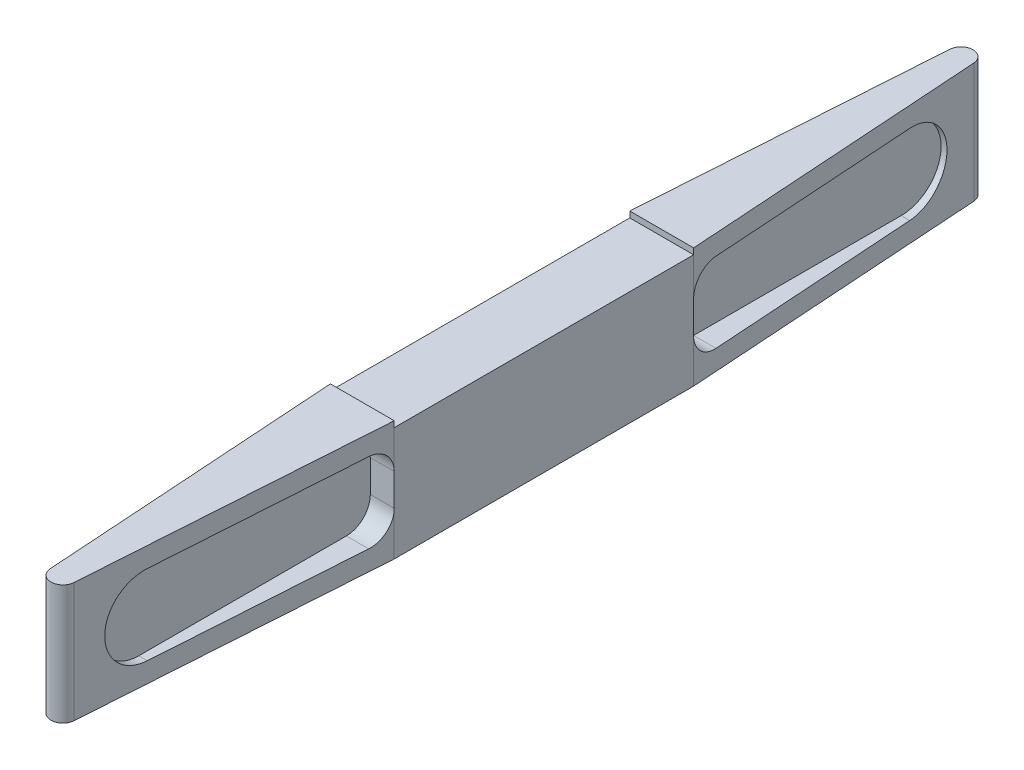
from build123d import *

# Parameters (mm, degrees)
BASE_EXTRUDE_DEPTH   = 30
CUT_EXTRUDE1_DEPTH   = 6
FILLET1_R            = 6
FILLET1_OF_MIRROR1_R = 6
MIRROR2_START        = -8
MIRROR2_DEPTH        = 6
MIRROR2_START_2      = 2
MIRROR2_2_DEPTH      = 6
SKETCH5_W            = 16
SKETCH5_H            = 75
CUT_EXTRUDE3_DEPTH   = 1.5


# Read off the part's stored shape, not the designer's step: Mirror2
with BuildPart() as part:
    # Sketch1 → Base-Extrude (new body)
    with BuildSketch(Plane(origin=(0, 0, 0), x_dir=(1, 0, 0), z_dir=(0, 1, 0))):
        with BuildLine():
            Line((8, 37.5), (2.993373056, 112.699293126))
            ThreePointArc((2.993373056, 112.699293126), (0, 115.5), (-2.993373056, 112.699293126))
            Line((-2.993373056, 112.699293126), (-8, 37.5))
            Line((-8, 37.5), (-8, -37.5))
            Line((-8, -37.5), (-2.993373056, -112.699293126))
            ThreePointArc((-2.993373056, -112.699293126), (0, -115.5), (2.993373056, -112.699293126))
            Line((2.993373056, -112.699293126), (8, -37.5))
            Line((8, -37.5), (8, 37.5))
        make_face()
    extrude(amount=BASE_EXTRUDE_DEPTH)

    # Sketch2 → Cut-Extrude1 (cut)
    with BuildSketch(Plane(origin=(8, 0, 0), x_dir=(0, 0, -1), z_dir=(1, 0, 0))):
        with BuildLine():
            Line((-37.5, 5), (-95.5, 5))
            ThreePointArc((-95.5, 5), (-105.5, 15), (-95.5, 25))
            Line((-95.5, 25), (-37.5, 25))
            Line((-37.5, 25), (-37.5, 5))
        make_face()
    cut_extrude1 = extrude(amount=-CUT_EXTRUDE1_DEPTH, mode=Mode.SUBTRACT)

    # Fillet1
    fillet1_edges = [part.edges().sort_by_distance(p)[0] for p in [
        (5, 25, 37.5),
        (5, 5, 37.5),
    ]]
    fillet(fillet1_edges, radius=FILLET1_R)

    # Mirror1: Cut-Extrude1 across plane
    add(cut_extrude1.mirror(Plane(origin=(0, 0, 0), x_dir=(0, 0, 1), z_dir=(1, 0, 0))), mode=Mode.SUBTRACT)

    # Fillet1 of Mirror1
    fillet1_of_mirror1_edges = [part.edges().sort_by_distance(p)[0] for p in [
        (-5, 25, 37.5),
        (-5, 5, 37.5),
    ]]
    fillet(fillet1_of_mirror1_edges, radius=FILLET1_OF_MIRROR1_R)

    # Mirror2 outline → Mirror2 (cut)
    with BuildSketch(Plane.YZ.offset(MIRROR2_START)):
        with BuildLine():
            Line((5, -43.5), (5, -95.5))
            ThreePointArc((5, -95.5), (15, -105.5), (25, -95.5))
            Line((25, -95.5), (25, -43.5))
            ThreePointArc((25, -43.5), (23.242640687, -39.257359313), (19, -37.5))
            Line((19, -37.5), (11, -37.5))
            ThreePointArc((11, -37.5), (6.757359313, -39.257359313), (5, -43.5))
        make_face()
    extrude(amount=MIRROR2_DEPTH, mode=Mode.SUBTRACT)

    # Mirror2 2 outline → Mirror2 2 (cut)
    with BuildSketch(Plane.YZ.offset(MIRROR2_START_2)):
        with BuildLine():
            Line((5, -43.5), (5, -95.5))
            ThreePointArc((5, -95.5), (15, -105.5), (25, -95.5))
            Line((25, -95.5), (25, -43.5))
            ThreePointArc((25, -43.5), (23.242640687, -39.257359313), (19, -37.5))
            Line((19, -37.5), (11, -37.5))
            ThreePointArc((11, -37.5), (6.757359313, -39.257359313), (5, -43.5))
        make_face()
    extrude(amount=MIRROR2_2_DEPTH, mode=Mode.SUBTRACT)

    # Sketch5 → Cut-Extrude3 (cut)
    with BuildSketch(Plane(origin=(0, 30, 0), x_dir=(-1, 0, 0), z_dir=(0, 1, 0))):
        Rectangle(SKETCH5_W, SKETCH5_H)
    extrude(amount=-CUT_EXTRUDE3_DEPTH, mode=Mode.SUBTRACT)


solid = part.part
